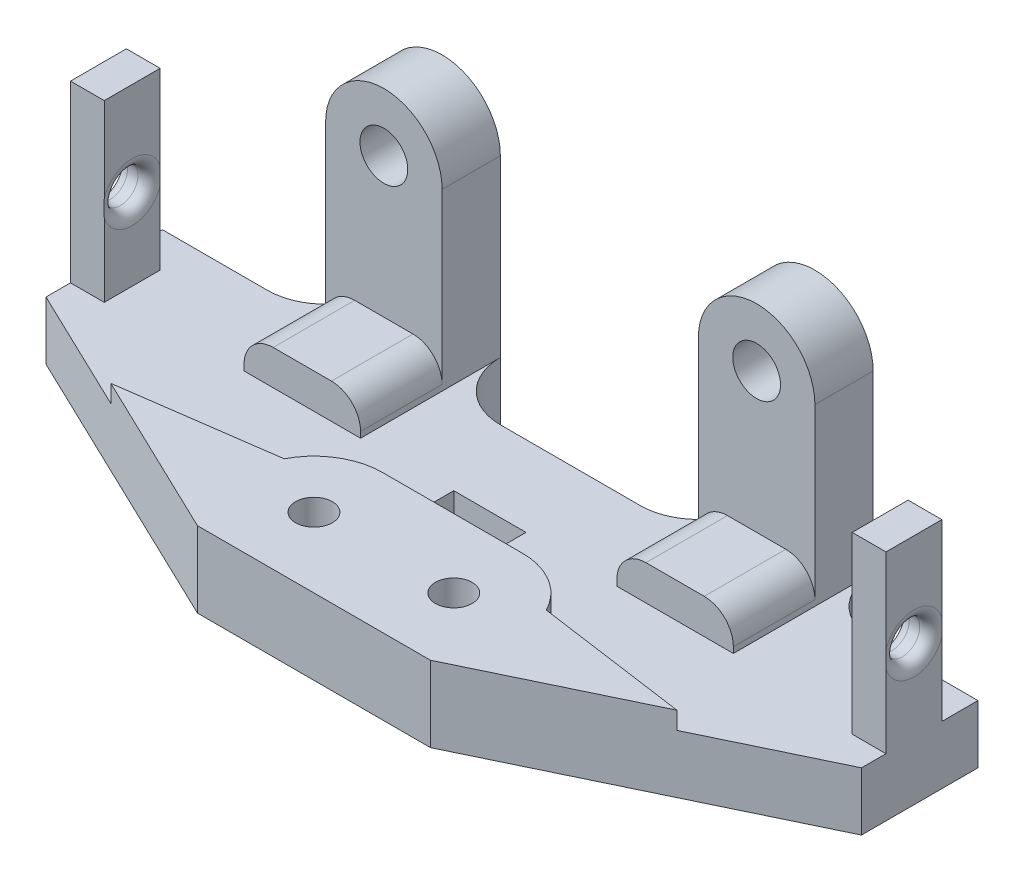
from build123d import *

# Parameters (mm, degrees)
BOSS_EXTRUDE1_DEPTH = 5
SKETCH2_R           = 1.575
CUT_EXTRUDE1_DEPTH  = 3
SKETCH10_W          = 2.9
SKETCH10_H          = 4.8
BOSS_EXTRUDE2_DEPTH = 15
SKETCH9_W           = 6.2
SKETCH9_H           = 3.2
CUT_EXTRUDE4_DEPTH  = 5
SKETCH11_R          = 1.5
CUT_EXTRUDE5_DEPTH  = 70
FILLET3_R           = 1
FILLET4_R           = 1
FILLET6_R           = 1
FILLET7_R           = 1
SKETCH15_R          = 2.05
BOSS_EXTRUDE6_DEPTH = 5
FILLET8_R           = 5
BOSS_EXTRUDE7_DEPTH = 7
SKETCH16_R          = 2.05
CUT_EXTRUDE6_DEPTH  = 10
BOSS_EXTRUDE8_START = 1.5
SKETCH18_R          = 1.575
BOSS_EXTRUDE8_DEPTH = 1.5


# Read off the part's stored shape, not the designer's step: Mirror1
with BuildPart() as part:
    # Sketch1 → Boss-Extrude1 (new body)
    with BuildSketch(Plane(origin=(0, 0, 0), x_dir=(1, 0, 0), z_dir=(0, 1, 0))):
        Polygon((0, 0), (20, 0), (45, 12), (45, 22), (-25, 22), (-25, 12), align=None)
    extrude(amount=BOSS_EXTRUDE1_DEPTH)

    # Sketch2 → Cut-Extrude1 (cut)
    with BuildSketch(Plane(origin=(0, 5, 0), x_dir=(1, 0, 0), z_dir=(0, 1, 0))):
        with Locations(Location((4, 6, 0), (0, 0, 270))):
            Circle(SKETCH2_R)
        with Locations(Location((16, 6, 0), (0, 0, 90))):
            Circle(SKETCH2_R)
    extrude(amount=-CUT_EXTRUDE1_DEPTH, mode=Mode.SUBTRACT)

    # Sketch10 → Boss-Extrude2 (add)
    with BuildSketch(Plane(origin=(0, 5, 0), x_dir=(1, 0, 0), z_dir=(0, 1, 0))):
        with Locations((-23.55, 16.5)):
            Rectangle(SKETCH10_W, SKETCH10_H)
        with Locations((43.55, 16.5)):
            Rectangle(SKETCH10_W, SKETCH10_H)
    extrude(amount=BOSS_EXTRUDE2_DEPTH)

    # Sketch9 → Cut-Extrude4 (cut)
    with BuildSketch(Plane(origin=(0, 5, 0), x_dir=(1, 0, 0), z_dir=(0, 1, 0))):
        with Locations((10, 13.5)):
            Rectangle(SKETCH9_W, SKETCH9_H)
    extrude(amount=-CUT_EXTRUDE4_DEPTH, mode=Mode.SUBTRACT)

    # Sketch11 → Cut-Extrude5 (cut)
    with BuildSketch(Plane.ZY.offset(25)):
        with Locations((-16.5, 12)):
            Circle(SKETCH11_R)
    extrude(amount=-CUT_EXTRUDE5_DEPTH, mode=Mode.SUBTRACT)

    # Fillet3
    # the kernel refuses this fillet: 1 mm, written as the material it takes off along each edge
    with BuildSketch(Plane(origin=(-25, 12, -16.5), x_dir=(0, 0, 1), z_dir=(0, -1, 0))) as fillet3_piece_1:
        with BuildLine():
            CenterArc((1.5 + FILLET3_R, -FILLET3_R), FILLET3_R, 90, 90)
            Line((1.5, -FILLET3_R), (1.5, 0))
            Line((1.5, 0), (1.5 + FILLET3_R, 0))
        make_face()
    revolve(axis=Axis((-25, 12, -16.5), (-1, 0, 0)), mode=Mode.SUBTRACT)

    # Fillet4
    # the kernel refuses this fillet: 1 mm, written as the material it takes off along each edge
    with BuildSketch(Plane(origin=(-22.1, 12, -16.5), x_dir=(0, 0, 1), z_dir=(0, -1, 0))) as fillet4_piece_1:
        with BuildLine():
            CenterArc((1.5 + FILLET4_R, FILLET4_R), FILLET4_R, 180, 90)
            Line((1.5, FILLET4_R), (1.5, 0))
            Line((1.5, 0), (1.5 + FILLET4_R, 0))
        make_face()
    revolve(axis=Axis((-22.1, 12, -16.5), (-1, 0, 0)), mode=Mode.SUBTRACT)

    # Fillet6
    # the kernel refuses this fillet: 1 mm, written as the material it takes off along each edge
    with BuildSketch(Plane(origin=(42.1, 12, -16.5), x_dir=(0, 0, 1), z_dir=(0, -1, 0))) as fillet6_piece_1:
        with BuildLine():
            CenterArc((1.5 + FILLET6_R, -FILLET6_R), FILLET6_R, 90, 90)
            Line((1.5, -FILLET6_R), (1.5, 0))
            Line((1.5, 0), (1.5 + FILLET6_R, 0))
        make_face()
    revolve(axis=Axis((42.1, 12, -16.5), (-1, 0, 0)), mode=Mode.SUBTRACT)

    # Fillet7
    # the kernel refuses this fillet: 1 mm, written as the material it takes off along each edge
    with BuildSketch(Plane(origin=(45, 12, -16.5), x_dir=(0, 0, 1), z_dir=(0, -1, 0))) as fillet7_piece_1:
        with BuildLine():
            CenterArc((1.5 + FILLET7_R, FILLET7_R), FILLET7_R, 180, 90)
            Line((1.5, FILLET7_R), (1.5, 0))
            Line((1.5, 0), (1.5 + FILLET7_R, 0))
        make_face()
    revolve(axis=Axis((45, 12, -16.5), (-1, 0, 0)), mode=Mode.SUBTRACT)

    # Sketch15 → Boss-Extrude6 (add)
    with BuildSketch(Plane(origin=(0, 0, -22), x_dir=(-1, 0, 0), z_dir=(0, 0, -1))):
        with BuildLine():
            Line((11, 0), (1, 0))
            Line((1, 0), (1, 20))
            ThreePointArc((1, 20), (6, 25), (11, 20))
            Line((11, 20), (11, 0))
        make_face()
        with Locations((6, 20)):
            Circle(SKETCH15_R, mode=Mode.SUBTRACT)
    extrude(amount=BOSS_EXTRUDE6_DEPTH)

    # Fillet8
    # the kernel refuses this fillet: 5 mm, written as the material it adds along each edge
    with BuildSketch(Plane(origin=(-11, 5, -22), x_dir=(-1, 0, 0), z_dir=(0, -1, 0)), Plane(origin=(-1, 0, -22), x_dir=(1, 0, 0), z_dir=(0, 1, 0))) as fillet8_piece_1:
        with BuildLine():
            CenterArc((FILLET8_R, FILLET8_R), FILLET8_R, 180, 90)
            Line((0, FILLET8_R), (0, 0))
            Line((0, 0), (FILLET8_R, 0))
        make_face()
    extrude(amount=5)

    # Sketch17 → Boss-Extrude7 (add)
    with BuildSketch(Plane.XY.offset(-22)):
        with BuildLine():
            Line((-11, 5), (-1, 5))
            Line((-1, 5), (-1, 5.5))
            ThreePointArc((-1, 5.5), (-1.732233047, 7.267766953), (-3.5, 8))
            Line((-3.5, 8), (-8.5, 8))
            ThreePointArc((-8.5, 8), (-10.267766953, 7.267766953), (-11, 5.5))
            Line((-11, 5.5), (-11, 5))
        make_face()
    extrude(amount=BOSS_EXTRUDE7_DEPTH)

    # Sketch16 → Cut-Extrude6 (cut)
    with BuildSketch(Plane(origin=(0, 0, -27), x_dir=(-1, 0, 0), z_dir=(0, 0, -1))):
        with Locations((6, 4)):
            Circle(SKETCH16_R)
    extrude(amount=-CUT_EXTRUDE6_DEPTH, mode=Mode.SUBTRACT)

    # Mirror1
    split(bisect_by=Plane(origin=(10, 0, 0), x_dir=(0, 0, 1), z_dir=(1, 0, 0)), keep=Keep.BOTTOM)

    # Mirror1 2: part across plane


with BuildPart() as part_1:
    add(part.part)
    add(part.part.mirror(Plane(origin=(10, 0, 0), x_dir=(0, 0, 1), z_dir=(1, 0, 0))))

    # Sketch18 → Boss-Extrude8 (add)
    with BuildSketch(Plane(origin=(0, 5, 0), x_dir=(1, 0, 0), z_dir=(0, 1, 0)).offset(BOSS_EXTRUDE8_START)):
        with BuildLine():
            Line((4, 11.9), (16, 11.9))
            ThreePointArc((16, 11.9), (19.074453288, 11.03564663), (21.248088251, 8.695843043))
            Line((21.248088251, 8.695843043), (34.2959978, 6.862078944))
            Line((34.2959978, 6.862078944), (20, 0))
            Line((20, 0), (0, 0))
            Line((0, 0), (-14.2959978, 6.862078944))
            Line((-14.2959978, 6.862078944), (-1.248088251, 8.695843043))
            ThreePointArc((-1.248088251, 8.695843043), (0.925546712, 11.03564663), (4, 11.9))
        make_face()
        with Locations(Location((4, 6, 0), (0, 0, 270))):
            Circle(SKETCH18_R, mode=Mode.SUBTRACT)
        with Locations(Location((16, 6, 0), (0, 0, 90))):
            Circle(SKETCH18_R, mode=Mode.SUBTRACT)
    extrude(amount=-BOSS_EXTRUDE8_DEPTH)


solid = part_1.part
